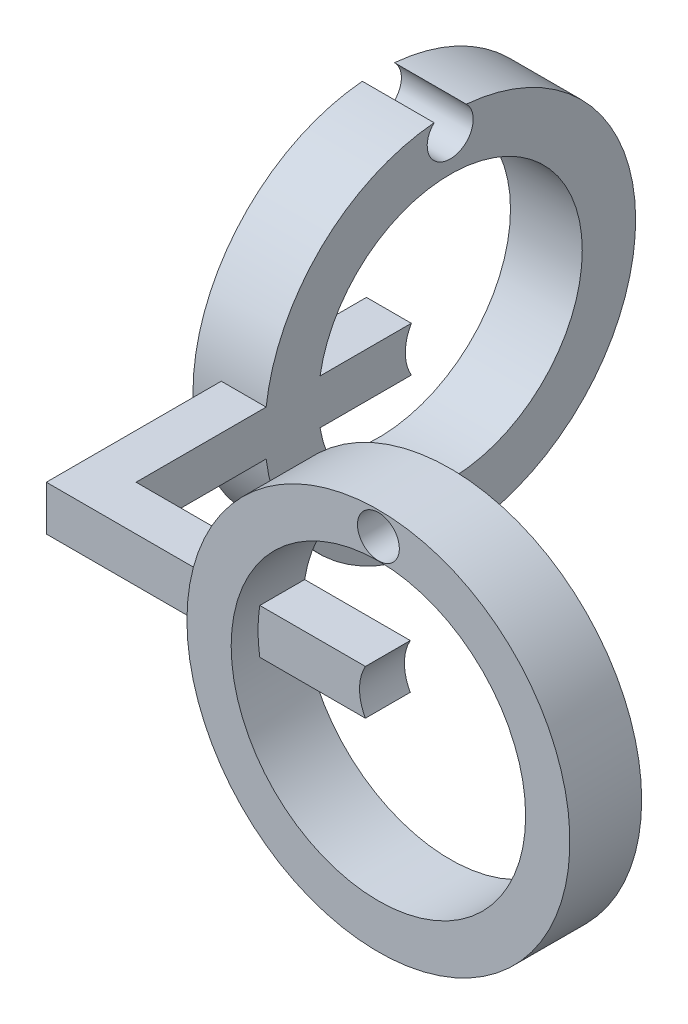
from build123d import *

# Parameters (mm, degrees)
BOSS_EXTRUDE1_DEPTH = 10
SKETCH3_R           = 5
BOSS_EXTRUDE2_DEPTH = 5
SKETCH4_W           = 12.842437823
SKETCH4_H           = 1
CUT_EXTRUDE1_DEPTH  = 5
SKETCH5_R           = 3.418084762
BOSS_EXTRUDE3_DEPTH = 5
SKETCH6_W           = 9.346993936
SKETCH6_H           = 1
CUT_EXTRUDE2_DEPTH  = 5
SKETCH7_R           = 42.668113091
SKETCH7_R_2         = 32.812087574
BOSS_EXTRUDE4_DEPTH = 16
SKETCH8_R           = 10.204262611
CUT_EXTRUDE3_DEPTH  = 16
SKETCH9_R           = 41.320841223
SKETCH9_R_2         = 29.431774833
BOSS_EXTRUDE5_DEPTH = 16
SKETCH10_R          = 10.002103031
CUT_EXTRUDE4_DEPTH  = 16
CUT_EXTRUDE5_DEPTH  = 16
SKETCH12_R          = 4.662079799
CUT_EXTRUDE6_DEPTH  = 16


with BuildPart() as part:
    # Sketch1 → Boss-Extrude1 (new body)
    with BuildSketch(Plane(origin=(0, 0, 0), x_dir=(1, 0, 0), z_dir=(0, 1, 0))):
        Polygon((0, 0), (0, 70), (-10, 70), (-10, -10), (70, -10), (70, 0), align=None)
    extrude(amount=BOSS_EXTRUDE1_DEPTH)

    # Sketch3 → Boss-Extrude2 (add)
    with BuildSketch(Plane.XY.offset(10)):
        with Locations((65, 5)):
            Circle(SKETCH3_R)
    extrude(amount=BOSS_EXTRUDE2_DEPTH)

    # Sketch4 → Cut-Extrude1 (cut)
    with BuildSketch(Plane.XY.offset(15)):
        with Locations((61.851491479, 5)):
            Rectangle(SKETCH4_W, SKETCH4_H)
    extrude(amount=-CUT_EXTRUDE1_DEPTH, mode=Mode.SUBTRACT)

    # Sketch5 → Boss-Extrude3 (add)
    with BuildSketch(Plane.ZY.offset(10)):
        with Locations((-44.354632579, 5)):
            Circle(SKETCH5_R)
    extrude(amount=BOSS_EXTRUDE3_DEPTH)

    # Sketch6 → Cut-Extrude2 (cut)
    with BuildSketch(Plane.ZY.offset(15)):
        with Locations((-49.962828941, 2.5)):
            Rectangle(SKETCH6_W, SKETCH6_H)
    extrude(amount=-CUT_EXTRUDE2_DEPTH, mode=Mode.SUBTRACT)

    # Sketch7 → Boss-Extrude4 (add)
    with BuildSketch(Plane(origin=(0, 0, 0), x_dir=(-1, 0, 0), z_dir=(0, 0, -1))):
        with Locations((-70, 5)):
            Circle(SKETCH7_R)
        with Locations((-70, 5)):
            Circle(SKETCH7_R_2, mode=Mode.SUBTRACT)
    extrude(amount=-BOSS_EXTRUDE4_DEPTH)

    # Sketch8 → Cut-Extrude3 (cut)
    with BuildSketch(Plane(origin=(0, 0, 0), x_dir=(-1, 0, 0), z_dir=(0, 0, -1))):
        with Locations((-70, 5)):
            Circle(SKETCH8_R)
    extrude(amount=-CUT_EXTRUDE3_DEPTH, mode=Mode.SUBTRACT)

    # Sketch9 → Boss-Extrude5 (add)
    with BuildSketch(Plane(origin=(0, 0, 0), x_dir=(0, 0, -1), z_dir=(1, 0, 0))):
        with Locations((70, 5)):
            Circle(SKETCH9_R)
        with Locations((70, 5)):
            Circle(SKETCH9_R_2, mode=Mode.SUBTRACT)
    extrude(amount=-BOSS_EXTRUDE5_DEPTH)

    # Sketch10 → Cut-Extrude4 (cut)
    with BuildSketch(Plane(origin=(0, 0, 0), x_dir=(0, 0, -1), z_dir=(1, 0, 0))):
        with Locations((70, 5)):
            Circle(SKETCH10_R)
    extrude(amount=-CUT_EXTRUDE4_DEPTH, mode=Mode.SUBTRACT)

    # Sketch11 → Cut-Extrude5 (cut)
    with BuildSketch(Plane(origin=(0, 0, 0), x_dir=(0, 0, -1), z_dir=(1, 0, 0))):
        with BuildLine():
            ThreePointArc((73.582845463, 46.165217572), (70, 46.320841223), (66.417154537, 46.165217572))
            ThreePointArc((66.417154537, 46.165217572), (70, 37.374514515), (73.582845463, 46.165217572))
        make_face()
    extrude(amount=-CUT_EXTRUDE5_DEPTH, mode=Mode.SUBTRACT)

    # Sketch12 → Cut-Extrude6 (cut)
    with BuildSketch(Plane(origin=(0, 0, 0), x_dir=(-1, 0, 0), z_dir=(0, 0, -1))):
        with Locations((-70, 42.5)):
            Circle(SKETCH12_R)
    extrude(amount=-CUT_EXTRUDE6_DEPTH, mode=Mode.SUBTRACT)


solid = part.part
